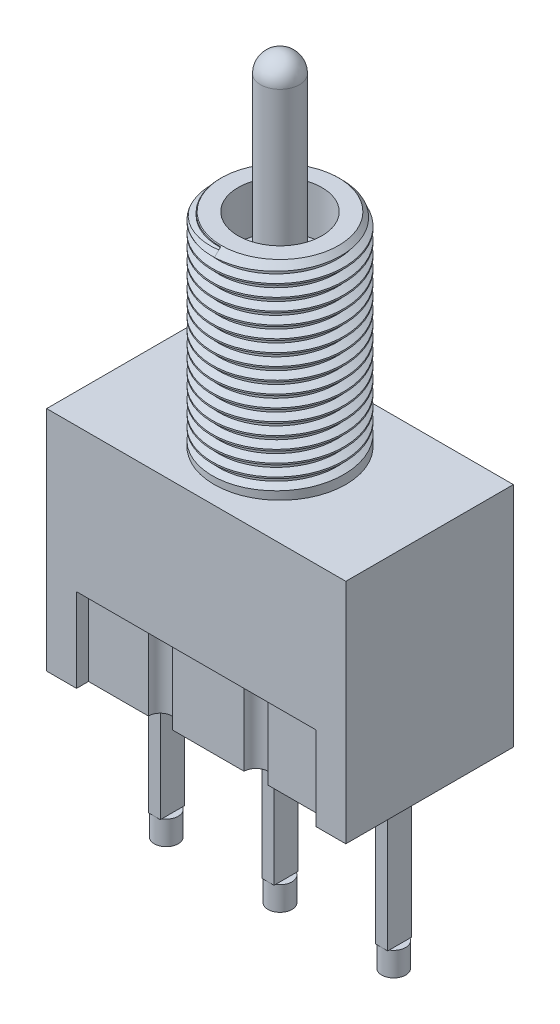
from build123d import *

# Parameters (mm, degrees)
SKETCH1_W              = 12.5
SKETCH1_H              = 7
BOSS_EXTRUDE1_DEPTH    = 9.5
CUT_EXTRUDE1_DEPTH     = 3.5
SKETCH3_W              = 1
SKETCH3_H              = 3
BOSS_EXTRUDE2_DEPTH    = 1
SKETCH4_W              = 0.5
SKETCH4_H              = 1
BOSS_EXTRUDE3_DEPTH    = 6
SKETCH5_R              = 2.75
BOSS_EXTRUDE4_DEPTH    = 8.5
CHAMFER1_SIZE          = 0.3
CUT_SWEEP2_PITCH       = 0.5
CUT_SWEEP2_HEIGHT      = 8.125
CUT_SWEEP2_RADIUS      = 2.4795
CUT_SWEEP2_START_ANGLE = 180
CUT_EXTRUDE2_DEPTH     = 2.8
SKETCH11_R             = 1.75
CUT_EXTRUDE3_DEPTH     = 2
SKETCH15_R             = 0.5
BOSS_EXTRUDE5_DEPTH    = 1
SKETCH16_R             = 0.814357512
BOSS_EXTRUDE6_DEPTH    = 7


with BuildPart() as part:
    # Sketch1 → Boss-Extrude1 (new body)
    with BuildSketch(Plane(origin=(0, 0, 0), x_dir=(1, 0, 0), z_dir=(0, 1, 0))):
        with Locations((0, 0.408667973)):
            Rectangle(SKETCH1_W, SKETCH1_H)
    extrude(amount=BOSS_EXTRUDE1_DEPTH)

    # Sketch2 → Cut-Extrude1 (cut)
    with BuildSketch(Plane.XZ):
        with BuildLine():
            Line((-5, 3.091332027), (5, 3.091332027))
            Line((5, 3.091332027), (5, 2.591332027))
            Line((5, 2.591332027), (2.5, 2.591332027))
            ThreePointArc((2.5, 2.591332027), (2, 2.091332027), (1.5, 2.591332027))
            Line((1.5, 2.591332027), (-1.5, 2.591332027))
            ThreePointArc((-1.5, 2.591332027), (-2, 2.091332027), (-2.5, 2.591332027))
            Line((-2.5, 2.591332027), (-5, 2.591332027))
            Line((-5, 2.591332027), (-5, 3.091332027))
        make_face()
        with BuildLine():
            Line((-5, -3.908667973), (5, -3.908667973))
            Line((5, -3.908667973), (5, -3.408667973))
            Line((5, -3.408667973), (2.5, -3.408667973))
            ThreePointArc((2.5, -3.408667973), (2, -2.908667973), (1.5, -3.408667973))
            Line((1.5, -3.408667973), (-1.5, -3.408667973))
            ThreePointArc((-1.5, -3.408667973), (-2, -2.908667973), (-2.5, -3.408667973))
            Line((-2.5, -3.408667973), (-5, -3.408667973))
            Line((-5, -3.408667973), (-5, -3.908667973))
        make_face()
    extrude(amount=-CUT_EXTRUDE1_DEPTH, mode=Mode.SUBTRACT)

    # Sketch3 → Boss-Extrude2 (add)
    with BuildSketch(Plane.XZ):
        with Locations((-2, -0.408667973)):
            Rectangle(SKETCH3_W, SKETCH3_H)
        with Locations((2, -0.408667973)):
            Rectangle(SKETCH3_W, SKETCH3_H)
    extrude(amount=BOSS_EXTRUDE2_DEPTH)

    # Sketch4 → Boss-Extrude3 (add)
    with BuildSketch(Plane.XZ):
        with Locations((-4.75, -0.408667973)):
            Rectangle(SKETCH4_W, SKETCH4_H)
        with Locations((4.75, -0.408667973)):
            Rectangle(SKETCH4_W, SKETCH4_H)
        with Locations((0, -0.408667973)):
            Rectangle(SKETCH4_W, SKETCH4_H)
    extrude(amount=BOSS_EXTRUDE3_DEPTH)

    # Sketch5 → Boss-Extrude4 (add)
    with BuildSketch(Plane(origin=(0, 9.5, 0), x_dir=(1, 0, 0), z_dir=(0, 1, 0))):
        with Locations((0, 0.408667973)):
            Circle(SKETCH5_R)
    extrude(amount=BOSS_EXTRUDE4_DEPTH)

    # Chamfer1
    chamfer1_edges = [part.edges().sort_by_distance(p)[0] for p in [
        (-2.75, 18, -0.408667973),
    ]]
    chamfer(chamfer1_edges, length=CHAMFER1_SIZE)

    # Cut-Sweep2: sweep along a helix
    with BuildLine() as cut_sweep2_path:
        add(Helix(CUT_SWEEP2_PITCH, CUT_SWEEP2_HEIGHT, CUT_SWEEP2_RADIUS, center=(0, 18, -0.408667973), direction=(0, -1, 0), mode=Mode.PRIVATE).rotate(Axis((0, 18, -0.408667973), (0, -1, 0)), CUT_SWEEP2_START_ANGLE))
    # Sketch8 → Cut-Sweep2 (sweep, cut)
    with BuildSketch(Plane(origin=(0, 0, 0), x_dir=(0, 0, -1), z_dir=(1, 0, 0))):
        Polygon((-2.070832027, 18.062500332), (-2.341457027, 18.218745748), (-2.591888811, 18.218745748), (-2.591888811, 17.781254252), (-2.341457027, 17.781254252), (-2.070832027, 17.937499668), align=None)
    sweep(path=cut_sweep2_path.line, is_frenet=True, mode=Mode.SUBTRACT)

    # Sketch9 → Cut-Extrude2 (cut)
    with BuildSketch(Plane.XY.offset(-0.408667973)):
        Polygon((-2.7500625, 10.093709664), (-2.7500625, 9.656254252), (-2.4795, 9.812499668), (-2.4795, 9.937500332), align=None)
    extrude(amount=-CUT_EXTRUDE2_DEPTH, mode=Mode.SUBTRACT)

    # Sketch11 → Cut-Extrude3 (cut)
    with BuildSketch(Plane(origin=(0, 18, 0), x_dir=(1, 0, 0), z_dir=(0, 1, 0))):
        with Locations((0, 0.408667973)):
            Circle(SKETCH11_R)
    extrude(amount=-CUT_EXTRUDE3_DEPTH, mode=Mode.SUBTRACT)

    # Sketch15 → Boss-Extrude5 (add)
    with BuildSketch(Plane.XZ.offset(6)):
        with Locations((0, -0.408667973)):
            Circle(SKETCH15_R)
        with Locations((4.75, -0.408667973)):
            Circle(SKETCH15_R)
        with Locations((-4.75, -0.408667973)):
            Circle(SKETCH15_R)
    extrude(amount=BOSS_EXTRUDE5_DEPTH)

    # Sketch16 → Boss-Extrude6 (add)
    with BuildSketch(Plane(origin=(0, 16, 0), x_dir=(1, 0, 0), z_dir=(0, 1, 0))):
        with Locations((0, 0.408667973)):
            Circle(SKETCH16_R)
    extrude(amount=BOSS_EXTRUDE6_DEPTH)

    # Sketch17 → Revolve1 (revolve)
    with BuildSketch(Plane(origin=(0, 23, 0), x_dir=(1, 0, 0), z_dir=(0, 1, 0))):
        with BuildLine():
            Line((-0.814357512, 0.408667973), (0.814357512, 0.408667973))
            ThreePointArc((0.814357512, 0.408667973), (0, -0.405689539), (-0.814357512, 0.408667973))
        make_face()
    revolve(axis=Axis((-0.814357512, 23, -0.408667973), (1, 0, 0)))


solid = part.part
